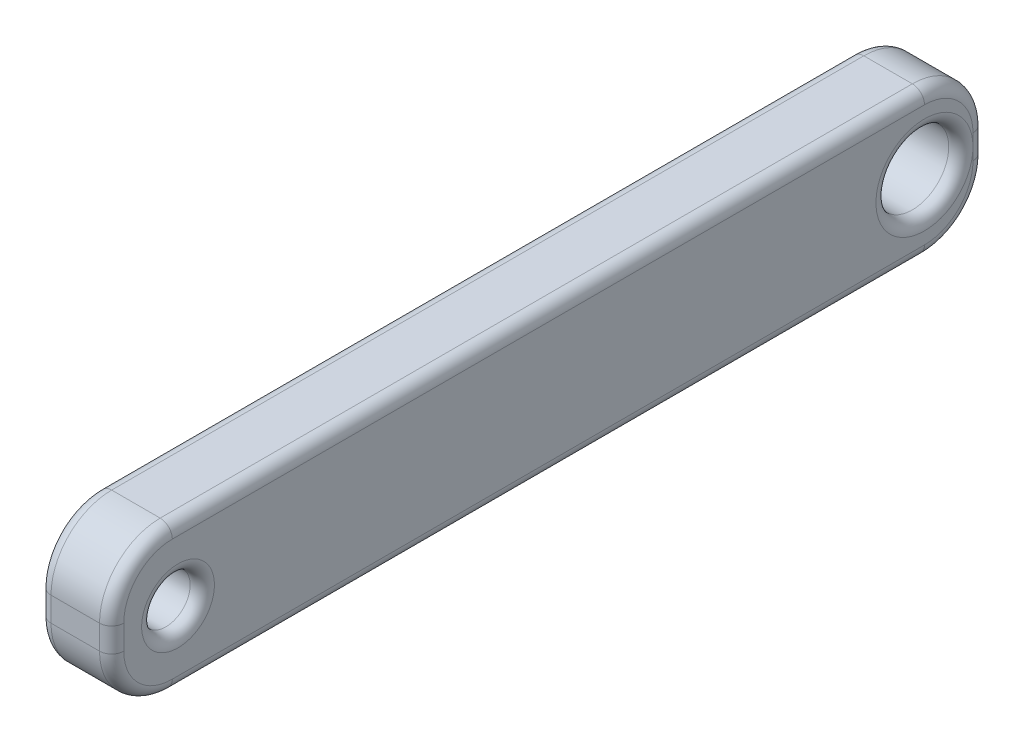
from build123d import *

# Parameters (mm, degrees)
SKETCH1_R           = 1
BOSS_EXTRUDE1_DEPTH = 3
SKETCH2_R           = 1.5
CUT_EXTRUDE1_DEPTH  = 10
FILLET1_R           = 0.5


with BuildPart() as part:
    # Sketch1 → Boss-Extrude1 (new body)
    with BuildSketch(Plane(origin=(0, 0, 0), x_dir=(0, 0, -1), z_dir=(1, 0, 0))):
        with BuildLine():
            Line((2.5, 0), (33.5, 0))
            ThreePointArc((33.5, 0), (35.267766953, 0.732233047), (36, 2.5))
            Line((36, 2.5), (36, 3.5))
            ThreePointArc((36, 3.5), (35.267766953, 5.267766953), (33.5, 6))
            Line((33.5, 6), (2.5, 6))
            ThreePointArc((2.5, 6), (0.732233047, 5.267766953), (0, 3.5))
            Line((0, 3.5), (0, 2.5))
            ThreePointArc((0, 2.5), (0.732233047, 0.732233047), (2.5, 0))
        make_face()
        with Locations((2.73587532, 3)):
            Circle(SKETCH1_R, mode=Mode.SUBTRACT)
    extrude(amount=BOSS_EXTRUDE1_DEPTH)

    # Sketch2 → Cut-Extrude1 (cut)
    with BuildSketch(Plane.ZY):
        with Locations((-33.5, 3)):
            Circle(SKETCH2_R)
    extrude(amount=-CUT_EXTRUDE1_DEPTH, mode=Mode.SUBTRACT)

    # Fillet1
    fillet1_edges = [part.edges().sort_by_distance(p)[0] for p in [
        (3, 5.267766953, -0.732233047),
        (0, 6, -18),
        (0, 5.267766953, -35.267766953),
        (3, 3, 0),
        (3, 0.732233047, -0.732233047),
        (3, 0, -18),
        (0, 3, -1.73587532),
        (3, 3, -1.73587532),
        (3, 0.732233047, -35.267766953),
        (3, 3, -36),
        (3, 3, -35),
        (0, 3, -35),
        (3, 5.267766953, -35.267766953),
        (3, 6, -18),
        (0, 3, -36),
        (0, 0.732233047, -35.267766953),
        (0, 0, -18),
        (0, 0.732233047, -0.732233047),
        (0, 3, 0),
        (0, 5.267766953, -0.732233047),
    ]]
    fillet(fillet1_edges, radius=FILLET1_R - 0.0001)  # a hair under: the kernel refuses the full size


solid = part.part
